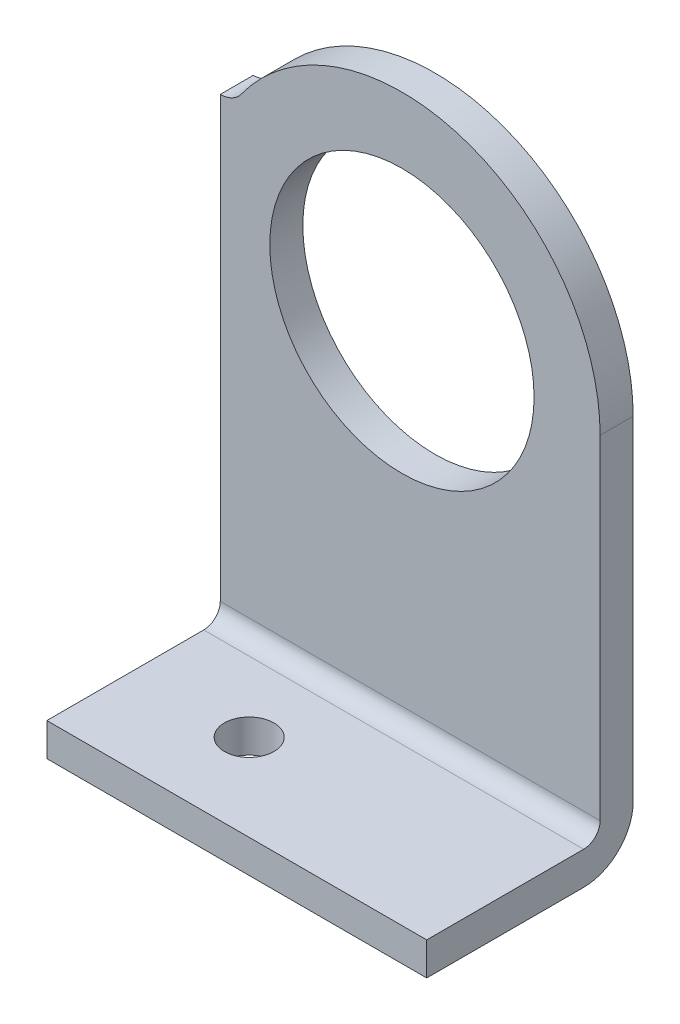
from build123d import *

# Parameters (mm, degrees)
SKETCH1_W               = 23
SKETCH1_H               = 12.5
BOSS_EXTRUDE1_DEPTH     = 2
SKETCH2_W               = 23
SKETCH2_H               = 33.206230298
BOSS_EXTRUDE2_DEPTH     = 2
SKETCH3_R               = 1.5
CUT_EXTRUDE1_DEPTH      = 2
SKETCH4_R               = 8
CUT_EXTRUDE2_DEPTH      = 2
CUT_EXTRUDE3_DEPTH      = 44.871729528
CUT_EXTRUDE3_DEPTH_BACK = 2
FILLET1_R               = 3
FILLET2_R               = 1


with BuildPart() as part:
    # Sketch1 → Boss-Extrude1 (new body)
    with BuildSketch(Plane(origin=(0, 0, 0), x_dir=(1, 0, 0), z_dir=(0, 1, 0))):
        with Locations((11.5, 6.25)):
            Rectangle(SKETCH1_W, SKETCH1_H)
    extrude(amount=BOSS_EXTRUDE1_DEPTH)

    # Sketch2 → Boss-Extrude2 (add)
    with BuildSketch(Plane(origin=(0, 0, -12.5), x_dir=(-1, 0, 0), z_dir=(0, 0, -1))):
        with Locations((-11.5, 18.603115149)):
            Rectangle(SKETCH2_W, SKETCH2_H)
    extrude(amount=-BOSS_EXTRUDE2_DEPTH)

    # Sketch3 → Cut-Extrude1 (cut)
    with BuildSketch(Plane(origin=(0, 2, 0), x_dir=(1, 0, 0), z_dir=(0, 1, 0))):
        with Locations((7, 5.25)):
            Circle(SKETCH3_R)
    extrude(amount=-CUT_EXTRUDE1_DEPTH, mode=Mode.SUBTRACT)

    # Sketch4 → Cut-Extrude2 (cut)
    with BuildSketch(Plane(origin=(0, 0, -12.5), x_dir=(-1, 0, 0), z_dir=(0, 0, -1))):
        with Locations((-11, 23.206230298)):
            Circle(SKETCH4_R)
    extrude(amount=-CUT_EXTRUDE2_DEPTH, mode=Mode.SUBTRACT)

    # Sketch6 → Cut-Extrude3 (cut, two sides: drawn at the far end of the back side and taken through both)
    with BuildSketch(Plane(origin=(0, 0, -12.5), x_dir=(-1, 0, 0), z_dir=(0, 0, -1)).offset(-CUT_EXTRUDE3_DEPTH_BACK)):
        with BuildLine():
            Line((-23, -61.737420213), (-23, 23.206230298))
            ThreePointArc((-23, 23.206230298), (-14.692788513, 34.623905762), (-1.272781167, 30.233407097))
            ThreePointArc((-1.272781167, 30.233407097), (-0.714730292, 29.754828233), (0, 29.582726176))
            Line((0, 29.582726176), (84.943650511, 29.582726176))
            Line((84.943650511, 29.582726176), (-24.781977419, 159.282308379))
            Line((-24.781977419, 159.282308379), (-132.72562793, 67.962161991))
            Line((-132.72562793, 67.962161991), (-23, -61.737420213))
        make_face()
    extrude(amount=CUT_EXTRUDE3_DEPTH + CUT_EXTRUDE3_DEPTH_BACK, mode=Mode.SUBTRACT)

    # Fillet1
    fillet1_edges = [part.edges().sort_by_distance(p)[0] for p in [
        (11.5, 0, -12.5),
    ]]
    fillet(fillet1_edges, radius=FILLET1_R)

    # Fillet2
    fillet2_edges = [part.edges().sort_by_distance(p)[0] for p in [
        (11.5, 2, -10.5),
    ]]
    fillet(fillet2_edges, radius=FILLET2_R)


solid = part.part
